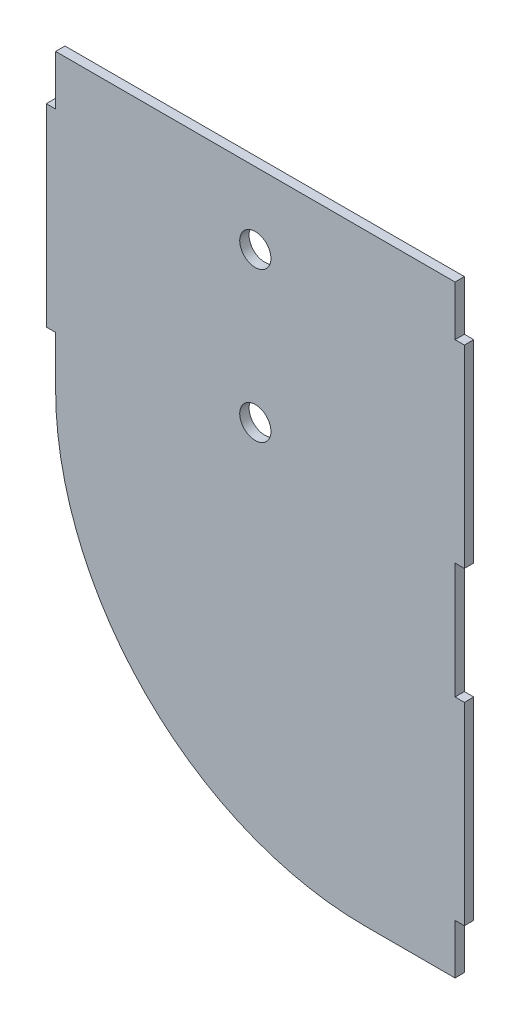
from build123d import *

# Parameters (mm, degrees)
EXTRUDE1_DEPTH     = 4.7625
CUT_EXTRUDE1_REACH = 313.634
SKETCH2_R          = 7.9375


with BuildPart() as part:
    # Sketch1 → Extrude1 (new body)
    with BuildSketch(Plane.XY):
        with BuildLine():
            Line((0, 74.6125), (-203.2, 74.6125))
            Line((-203.2, 74.6125), (-203.2, 49.2125))
            Line((-203.2, 49.2125), (-207.9625, 49.2125))
            Line((-207.9625, 49.2125), (-207.9625, -49.2125))
            Line((-207.9625, -49.2125), (-203.2, -49.2125))
            Line((-203.2, -49.2125), (-203.2, -74.6125))
            ThreePointArc((-203.2, -74.6125), (-157.089210331, -185.933793792), (-45.767916539, -232.044583461))
            Line((-45.767916539, -232.044583461), (0, -232.044583461))
            Line((0, -232.044583461), (0, -206.644583461))
            Line((0, -206.644583461), (4.7625, -206.644583461))
            Line((4.7625, -206.644583461), (4.7625, -108.219583461))
            Line((4.7625, -108.219583461), (0, -108.219583461))
            Line((0, -108.219583461), (0, -49.2125))
            Line((0, -49.2125), (4.7625, -49.2125))
            Line((4.7625, -49.2125), (4.7625, 49.2125))
            Line((4.7625, 49.2125), (0, 49.2125))
            Line((0, 49.2125), (0, 74.6125))
        make_face()
    extrude(amount=-EXTRUDE1_DEPTH)

    # Sketch2 → Cut-Extrude1 (cut, up to next)
    with BuildSketch(Plane.XY, mode=Mode.PRIVATE) as cut_extrude1_sk1:
        with Locations((-101.6, 38.1)):
            Circle(SKETCH2_R)
    cut_extrude1_tool1 = extrude(cut_extrude1_sk1.sketch, amount=-CUT_EXTRUDE1_REACH, mode=Mode.PRIVATE) & part.part
    # Sketch2 → Cut-Extrude1 (cut, up to next)
    with BuildSketch(Plane.XY, mode=Mode.PRIVATE) as cut_extrude1_sk2:
        with Locations((-101.6, -38.1)):
            Circle(SKETCH2_R)
    cut_extrude1_tool2 = extrude(cut_extrude1_sk2.sketch, amount=-CUT_EXTRUDE1_REACH, mode=Mode.PRIVATE) & part.part
    add(cut_extrude1_tool1.solids().sort_by_distance((-101.6, 38.1, 0))[0], mode=Mode.SUBTRACT)
    add(cut_extrude1_tool2.solids().sort_by_distance((-101.6, -38.1, 0))[0], mode=Mode.SUBTRACT)


solid = part.part
